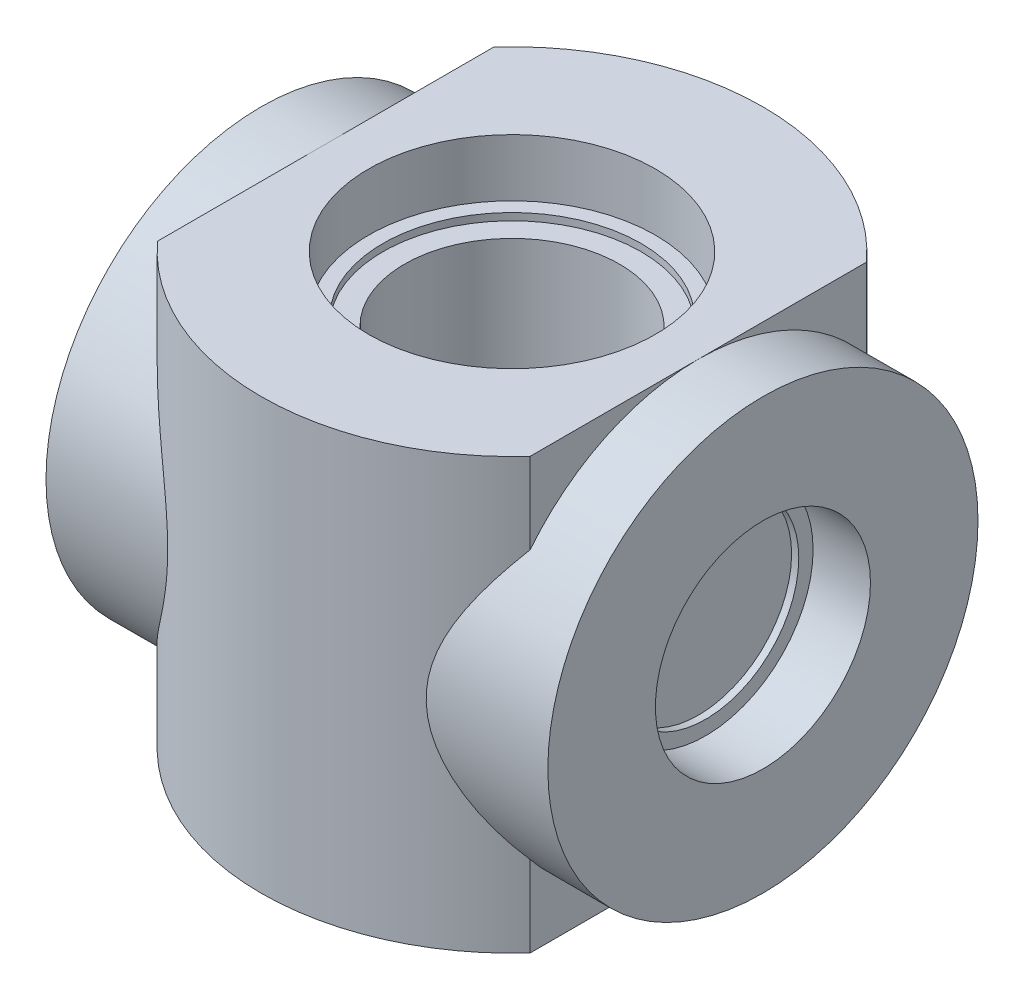
from build123d import *

# Parameters (mm, degrees)
BOSS_EXTRUDE1_DEPTH = 15


with BuildPart() as part:
    # Sketch3 → Revolve1 (revolve)
    with BuildSketch(Plane(origin=(0, 0, 0), x_dir=(1, 0, 0), z_dir=(0, 1, 0))):
        Polygon((-13, 6.5), (-13, 0), (0, 0), (0, 15), (-17.5, 15), (-17.5, 7.5), (-13.5, 7.5), (-13.5, 6.5), align=None)
    revolve1 = revolve(axis=Axis((0, 0, 0), (-1, 0, 0)))

    # Mirror1: Revolve1 across plane
    add(revolve1.mirror(Plane(origin=(0, 0, 0), x_dir=(0, 0, 1), z_dir=(1, 0, 0))))

    # Sketch6 → Boss-Extrude1 (add, symmetric)
    with BuildSketch(Plane(origin=(0, 0, 0), x_dir=(1, 0, 0), z_dir=(0, 1, 0))):
        with BuildLine():
            ThreePointArc((12.993588105, 11.722485579), (0, 17.5), (-12.993588105, 11.722485579))
            Line((-12.993588105, 11.722485579), (-12.993588105, -11.722485579))
            ThreePointArc((-12.993588105, -11.722485579), (0, -17.5), (12.993588105, -11.722485579))
            Line((12.993588105, -11.722485579), (12.993588105, 11.722485579))
        make_face()
    extrude(amount=BOSS_EXTRUDE1_DEPTH, both=True)

    # Sketch8 → Cut-Revolve1 (revolve, cut)
    with BuildSketch(Plane.XY):
        Polygon((0, -15), (10, -15), (10, -11), (9, -11), (9, -10.5), (7.5, -10.5), (7.5, 10.5), (9, 10.5), (9, 11), (10, 11), (10, 15), (0, 15), align=None)
    revolve(axis=Axis((0, 15, 0), (0, -1, 0)), mode=Mode.SUBTRACT)


solid = part.part
